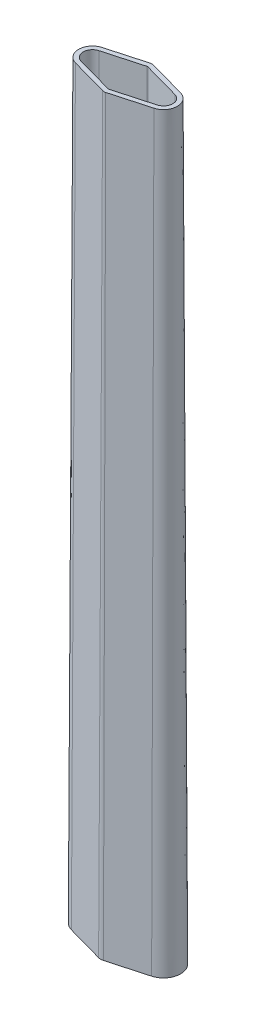
from build123d import *

# Parameters (mm, degrees)
BOSS_EXTRUDE1_DEPTH = 250
BOSS_EXTRUDE1_TAPER = 0.25


with BuildPart() as part:
    # Sketch1 → Boss-Extrude1 (new body)
    with BuildSketch(Plane(origin=(0, 0, 0), x_dir=(1, 0, 0), z_dir=(0, 1, 0))):
        with BuildLine():
            ThreePointArc((-13.378044047, 5.491364256), (-17.55, 0), (-13.378044047, -5.491364256))
            Line((-13.378044047, -5.491364256), (-0.804233709, -8.990191714))
            ThreePointArc((-0.804233709, -8.990191714), (0, -9.1), (0.804233709, -8.990191714))
            Line((0.804233709, -8.990191714), (13.378044047, -5.491364256))
            ThreePointArc((13.378044047, -5.491364256), (17.55, 0), (13.378044047, 5.491364256))
            Line((13.378044047, 5.491364256), (0.804233709, 8.990191714))
            ThreePointArc((0.804233709, 8.990191714), (0, 9.1), (-0.804233709, 8.990191714))
            Line((-0.804233709, 8.990191714), (-13.378044047, 5.491364256))
        make_face()
    extrude(amount=BOSS_EXTRUDE1_DEPTH, taper=BOSS_EXTRUDE1_TAPER)

    # Shell1: read off the stored shape, not the designer's step
    # Shell1: loft between two sections, ruled curve by curve
    shell1_from = [
        Edge.make_three_point_arc((12.68349388, 250, -2.99534461), (14.959148016, 250, 0), (12.68349388, 250, 2.99534461)),
        Edge.make_three_point_arc((-0.109683542, 250, -6.494172068), (0, 250, -6.509148016), (0.109683542, 250, -6.494172068)),
        Edge.make_three_point_arc((-12.68349388, 250, 2.99534461), (-14.959148016, 250, 0), (-12.68349388, 250, -2.99534461)),
        Edge.make_three_point_arc((0.109683542, 250, 6.494172068), (0, 250, 6.509148016), (-0.109683542, 250, 6.494172068)),
        Edge.make_line((12.68349388, 250, -2.99534461), (0.109683542, 250, -6.494172068)),
        Edge.make_line((-0.109683542, 250, -6.494172068), (-12.68349388, 250, -2.99534461)),
        Edge.make_line((-12.68349388, 250, 2.99534461), (-0.109683542, 250, 6.494172068)),
        Edge.make_line((0.109683542, 250, 6.494172068), (12.68349388, 250, 2.99534461)),
    ]
    shell1_to = [
        Edge.make_three_point_arc((12.975923365, 0, -4.046254643), (16.049985721, 0, 0), (12.975923365, 0, 4.046254643)),
        Edge.make_three_point_arc((-0.402113027, 0, -7.5450821), (0, 0, -7.599985721), (0.402113027, 0, -7.5450821)),
        Edge.make_three_point_arc((-12.975923365, 0, 4.046254643), (-16.049985721, 0, 0), (-12.975923365, 0, -4.046254643)),
        Edge.make_three_point_arc((0.402113027, 0, 7.5450821), (0, 0, 7.599985721), (-0.402113027, 0, 7.5450821)),
        Edge.make_line((12.975923365, 0, -4.046254643), (0.402113027, 0, -7.5450821)),
        Edge.make_line((-0.402113027, 0, -7.5450821), (-12.975923365, 0, -4.046254643)),
        Edge.make_line((-12.975923365, 0, 4.046254643), (-0.402113027, 0, 7.5450821)),
        Edge.make_line((0.402113027, 0, 7.5450821), (12.975923365, 0, 4.046254643)),
    ]
    shell1 = Solid(Shell([*[Face.make_surface_from_curves(shell1_from[k], shell1_to[k]) for k in range(8)], Face(Wire(shell1_from)), Face(Wire(shell1_to))]))
    add(shell1, mode=Mode.SUBTRACT)


solid = part.part
